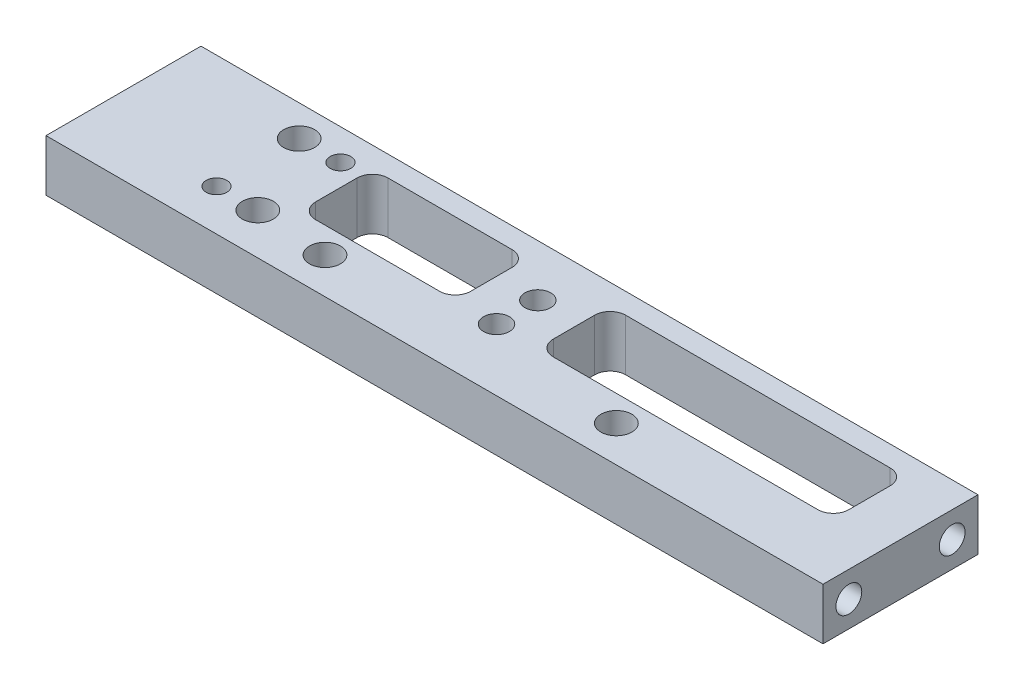
from build123d import *

# Parameters (mm, degrees)
SKETCH1_W                       = 15
SKETCH1_H                       = 5
BOSS_EXTRUDE1_DEPTH             = 75.2
TAP_DRILL_FOR_M3X0_5_TAP1_D     = 2.5
TAP_DRILL_FOR_M3X0_5_TAP1_DEPTH = 3
TAP_DRILL_FOR_M3X0_5_TAP1_TIP   = 0.751075774
TAP_DRILL_FOR_M3X0_5_TAP2_D     = 2.5
TAP_DRILL_FOR_M3X0_5_TAP2_DEPTH = 3
TAP_DRILL_FOR_M3X0_5_TAP2_TIP   = 0.751075774
CUT_EXTRUDE1_REACH              = 78.844
SKETCH6_R                       = 1.5
SKETCH6_R_2                     = 1
SKETCH6_W                       = 28.6
SKETCH6_H                       = 7
SKETCH6_W_2                     = 15
FILLET1_R                       = 1.5
CHAMFER1_SIZE                   = 1.5
TAP_DRILL_FOR_M3X0_5_TAP3_D     = 2.5


with BuildPart() as part:
    # Sketch1 → Boss-Extrude1 (new body)
    with BuildSketch(Plane(origin=(0, 0, 0), x_dir=(0, 0, -1), z_dir=(1, 0, 0))):
        with Locations((7.5, 2.5)):
            Rectangle(SKETCH1_W, SKETCH1_H)
    extrude(amount=BOSS_EXTRUDE1_DEPTH)

    # Tap Drill for M3x0.5 Tap1
    with Locations(Plane(origin=(75.2, 0, 0), x_dir=(0, 0, -1), z_dir=(1, 0, 0))):
        with Locations((2.5, 2.5), (12.5, 2.5)):
            Hole(TAP_DRILL_FOR_M3X0_5_TAP1_D / 2, depth=TAP_DRILL_FOR_M3X0_5_TAP1_DEPTH)
            with Locations((0, 0, -(TAP_DRILL_FOR_M3X0_5_TAP1_DEPTH + TAP_DRILL_FOR_M3X0_5_TAP1_TIP / 2))):  # 118° drill point
                Cone(0, TAP_DRILL_FOR_M3X0_5_TAP1_D / 2, TAP_DRILL_FOR_M3X0_5_TAP1_TIP, mode=Mode.SUBTRACT)

    # Tap Drill for M3x0.5 Tap2
    with Locations(Plane.ZY):
        with Locations((-2.5, 2.5), (-12.5, 2.5)):
            Hole(TAP_DRILL_FOR_M3X0_5_TAP2_D / 2, depth=TAP_DRILL_FOR_M3X0_5_TAP2_DEPTH)
            with Locations((0, 0, -(TAP_DRILL_FOR_M3X0_5_TAP2_DEPTH + TAP_DRILL_FOR_M3X0_5_TAP2_TIP / 2))):  # 118° drill point
                Cone(0, TAP_DRILL_FOR_M3X0_5_TAP2_D / 2, TAP_DRILL_FOR_M3X0_5_TAP2_TIP, mode=Mode.SUBTRACT)

    # Sketch6 → Cut-Extrude1 (cut, up to next)
    with BuildSketch(Plane(origin=(0, 5, 0), x_dir=(1, 0, 0), z_dir=(0, 1, 0)), mode=Mode.PRIVATE) as cut_extrude1_sk1:
        with Locations(Location((23.5, 3.5, 0), (0, 0, 270))):
            Circle(SKETCH6_R)
    cut_extrude1_tool1 = extrude(cut_extrude1_sk1.sketch, amount=-CUT_EXTRUDE1_REACH, mode=Mode.PRIVATE) & part.part
    # Sketch6 → Cut-Extrude1 (cut, up to next)
    with BuildSketch(Plane(origin=(0, 5, 0), x_dir=(1, 0, 0), z_dir=(0, 1, 0)), mode=Mode.PRIVATE) as cut_extrude1_sk2:
        with Locations(Location((51.7, 3.5, 0), (0, 0, 270))):
            Circle(SKETCH6_R)
    cut_extrude1_tool2 = extrude(cut_extrude1_sk2.sketch, amount=-CUT_EXTRUDE1_REACH, mode=Mode.PRIVATE) & part.part
    # Sketch6 → Cut-Extrude1 (cut, up to next)
    with BuildSketch(Plane(origin=(0, 5, 0), x_dir=(1, 0, 0), z_dir=(0, 1, 0)), mode=Mode.PRIVATE) as cut_extrude1_sk3:
        with Locations(Location((12.5, 12, 0), (0, 0, 270))):
            Circle(SKETCH6_R)
    cut_extrude1_tool3 = extrude(cut_extrude1_sk3.sketch, amount=-CUT_EXTRUDE1_REACH, mode=Mode.PRIVATE) & part.part
    # Sketch6 → Cut-Extrude1 (cut, up to next)
    with BuildSketch(Plane(origin=(0, 5, 0), x_dir=(1, 0, 0), z_dir=(0, 1, 0)), mode=Mode.PRIVATE) as cut_extrude1_sk4:
        with Locations(Location((16.5, 12, 0), (0, 0, 270))):
            Circle(SKETCH6_R_2)
    cut_extrude1_tool4 = extrude(cut_extrude1_sk4.sketch, amount=-CUT_EXTRUDE1_REACH, mode=Mode.PRIVATE) & part.part
    # Sketch6 → Cut-Extrude1 (cut, up to next)
    with BuildSketch(Plane(origin=(0, 5, 0), x_dir=(1, 0, 0), z_dir=(0, 1, 0)), mode=Mode.PRIVATE) as cut_extrude1_sk5:
        with Locations(Location((12.5, 4, 0), (0, 0, 270))):
            Circle(SKETCH6_R_2)
    cut_extrude1_tool5 = extrude(cut_extrude1_sk5.sketch, amount=-CUT_EXTRUDE1_REACH, mode=Mode.PRIVATE) & part.part
    # Sketch6 → Cut-Extrude1 (cut, up to next)
    with BuildSketch(Plane(origin=(0, 5, 0), x_dir=(1, 0, 0), z_dir=(0, 1, 0)), mode=Mode.PRIVATE) as cut_extrude1_sk6:
        with Locations(Location((16.5, 4, 0), (0, 0, 270))):
            Circle(SKETCH6_R)
    cut_extrude1_tool6 = extrude(cut_extrude1_sk6.sketch, amount=-CUT_EXTRUDE1_REACH, mode=Mode.PRIVATE) & part.part
    # Sketch6 → Cut-Extrude1 (cut, up to next)
    with BuildSketch(Plane(origin=(0, 5, 0), x_dir=(1, 0, 0), z_dir=(0, 1, 0)), mode=Mode.PRIVATE) as cut_extrude1_sk7:
        with Locations((55.9, 9.5)):
            Rectangle(SKETCH6_W, SKETCH6_H)
    cut_extrude1_tool7 = extrude(cut_extrude1_sk7.sketch, amount=-CUT_EXTRUDE1_REACH, mode=Mode.PRIVATE) & part.part
    # Sketch6 → Cut-Extrude1 (cut, up to next)
    with BuildSketch(Plane(origin=(0, 5, 0), x_dir=(1, 0, 0), z_dir=(0, 1, 0)), mode=Mode.PRIVATE) as cut_extrude1_sk8:
        with Locations((26.1, 9.5)):
            Rectangle(SKETCH6_W_2, SKETCH6_H)
    cut_extrude1_tool8 = extrude(cut_extrude1_sk8.sketch, amount=-CUT_EXTRUDE1_REACH, mode=Mode.PRIVATE) & part.part
    add(cut_extrude1_tool1.solids().sort_by_distance((23.5, 5, -3.5))[0], mode=Mode.SUBTRACT)
    add(cut_extrude1_tool2.solids().sort_by_distance((51.7, 5, -3.5))[0], mode=Mode.SUBTRACT)
    add(cut_extrude1_tool3.solids().sort_by_distance((12.5, 5, -12))[0], mode=Mode.SUBTRACT)
    add(cut_extrude1_tool4.solids().sort_by_distance((16.5, 5, -12))[0], mode=Mode.SUBTRACT)
    add(cut_extrude1_tool5.solids().sort_by_distance((12.5, 5, -4))[0], mode=Mode.SUBTRACT)
    add(cut_extrude1_tool6.solids().sort_by_distance((16.5, 5, -4))[0], mode=Mode.SUBTRACT)
    add(cut_extrude1_tool7.solids().sort_by_distance((55.9, 5, -9.5))[0], mode=Mode.SUBTRACT)
    add(cut_extrude1_tool8.solids().sort_by_distance((26.1, 5, -9.5))[0], mode=Mode.SUBTRACT)

    # Fillet1
    fillet1_edges = [part.edges().sort_by_distance(p)[0] for p in [
        (70.2, 2.5, -13),
        (70.2, 2.5, -6),
        (41.6, 2.5, -6),
        (41.6, 2.5, -13),
        (18.6, 2.5, -6),
        (18.6, 2.5, -13),
        (33.6, 2.5, -13),
        (33.6, 2.5, -6),
    ]]
    fillet(fillet1_edges, radius=FILLET1_R)

    # Chamfer1
    chamfer1_edges = [part.edges().sort_by_distance(p)[0] for p in [
        (12.5, 0, -13.5),
        (16.5, 0, -5.5),
    ]]
    chamfer(chamfer1_edges, length=CHAMFER1_SIZE - 0.0001)  # a hair under: the kernel refuses the full size

    # Tap Drill for M3x0.5 Tap3 (through all)
    with Locations(Plane(origin=(0, 5, 0), x_dir=(1, 0, 0), z_dir=(0, 1, 0))):
        with Locations((37.6, 10), (37.6, 6)):
            Hole(TAP_DRILL_FOR_M3X0_5_TAP3_D / 2)


solid = part.part
